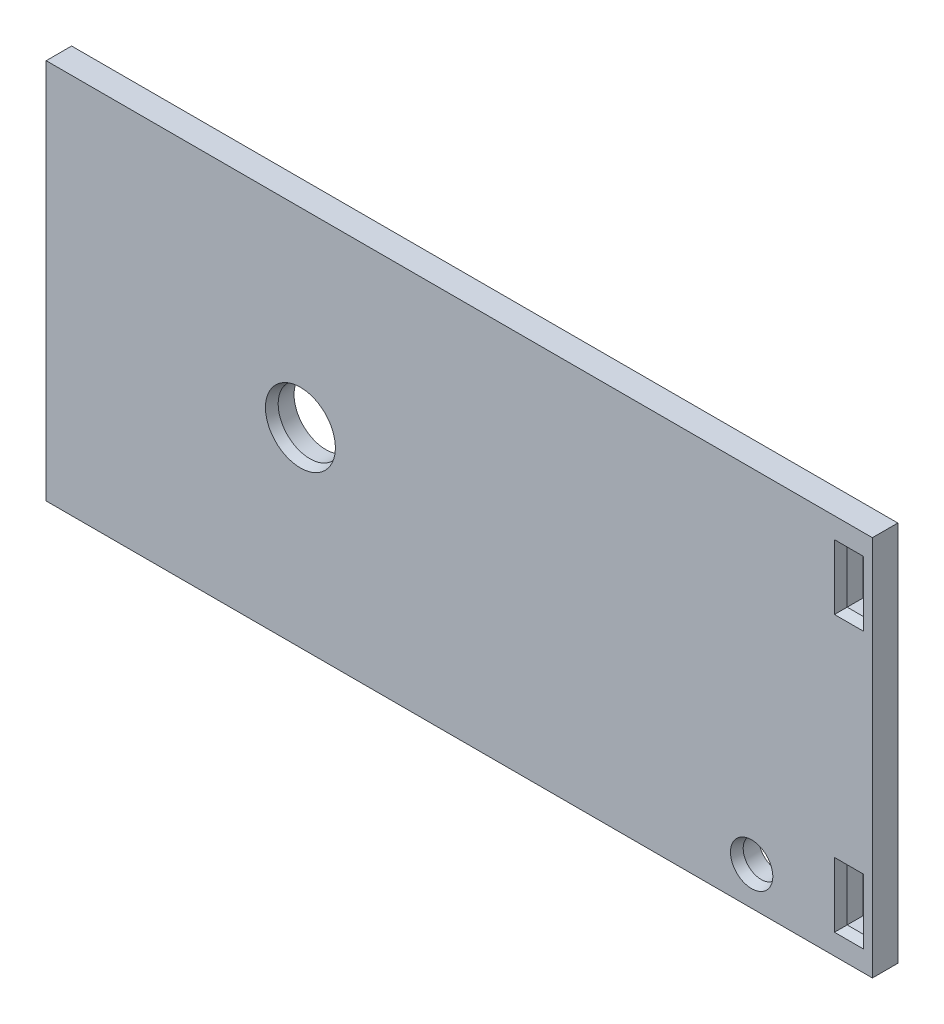
from build123d import *

# Parameters (mm, degrees)
SKETCH1_W           = 130
SKETCH1_H           = 60
SKETCH1_R           = 5
SKETCH1_R_2         = 2.83
SKETCH1_W_2         = 3.53
SKETCH1_H_2         = 9.2
BOSS_EXTRUDE1_DEPTH = 2
CHAMFER1_SIZE       = 0.5
CHAMFER1_SIZE2      = 1.5


with BuildPart() as part:
    # Sketch1 → Boss-Extrude1 (new, symmetric)
    with BuildSketch(Plane.XY):
        Rectangle(SKETCH1_W, SKETCH1_H)
        with Locations((-25, 0)):
            Circle(SKETCH1_R, mode=Mode.SUBTRACT)
        with Locations((46, -24)):
            Circle(SKETCH1_R_2, mode=Mode.SUBTRACT)
        with Locations((61.3, 21.65)):
            Rectangle(SKETCH1_W_2, SKETCH1_H_2, mode=Mode.SUBTRACT)
        with Locations((61.3, -21.65)):
            Rectangle(SKETCH1_W_2, SKETCH1_H_2, mode=Mode.SUBTRACT)
    extrude(amount=BOSS_EXTRUDE1_DEPTH, both=True)

    # Chamfer1
    chamfer1_edges = [part.edges().sort_by_distance(p)[0] for p in [
        (61.3, 17.05, 2),
        (59.535, 21.65, 2),
        (61.3, 26.25, 2),
        (63.065, 21.65, 2),
        (-30, 0, 2),
        (43.17, -24, 2),
        (61.3, -26.25, 2),
        (59.535, -21.65, 2),
        (61.3, -17.05, 2),
        (63.065, -21.65, 2),
    ]]
    chamfer1_side = [part.faces().sort_by_distance(p)[0] for p in [
        (-0.416106653, 0.079128468, 2),
    ]]
    chamfer(chamfer1_edges, length=CHAMFER1_SIZE, length2=CHAMFER1_SIZE2, reference=chamfer1_side[0])


solid = part.part
